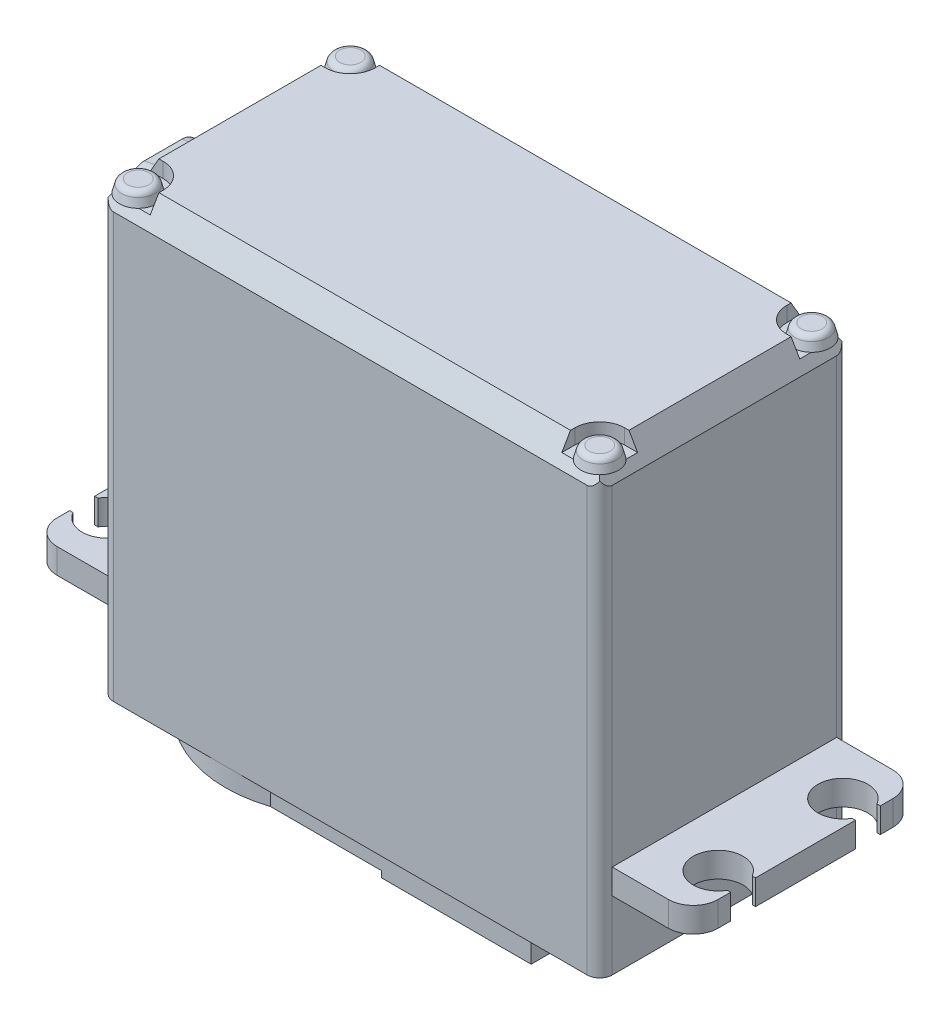
from build123d import *

# Parameters (mm, degrees)
SKETCH_1_W                 = 40
SKETCH_1_H                 = 20
EXTRUDE_1_DEPTH            = 28.5
SKETCH_7_R                 = 2.5
EXTRUDE_4_DEPTH            = 6.975384219
SKETCH_1_2_W               = 40
SKETCH_1_2_H               = 20
EXTRUDE_5_DEPTH            = 7.5
SKETCH_3_W                 = 53
SKETCH_3_H                 = 18
EXTRUDE_6_DEPTH            = 2
CUT_EXTRUDE_4_DEPTH        = 5
EXTRUDE_7_DEPTH            = 1.5
SKETCH_13_W                = 12
SKETCH_13_H                = 19
EXTRUDE_8_DEPTH            = 2
SKETCH_14_R                = 6
EXTRUDE_9_DEPTH            = 1.5
EXTRUDE_10_DEPTH           = 0.25
CUT_EXTRUDE_5_DEPTH        = 50
CUT_EXTRUDE_6_DEPTH        = 50
CUT_EXTRUDE_11_DEPTH       = 1.2
SKETCH_25_R                = 1.5
EXTRUDE_12_DEPTH           = 1
EXTRUDE_12_DRAFT           = 15
EXTRUDE_12_PROFILE_2_DEPTH = 1
EXTRUDE_12_PROFILE_2_DRAFT = 15
EXTRUDE_12_PROFILE_3_DEPTH = 1
EXTRUDE_12_PROFILE_3_DRAFT = 15
EXTRUDE_12_PROFILE_4_DEPTH = 1
EXTRUDE_12_PROFILE_4_DRAFT = 15
SKETCH_29_R                = 6.25
EXTRUDE_15_DEPTH           = 1.2
SKETCH_30_R                = 5
EXTRUDE_16_DEPTH           = 0.3
EXTRUDE_17_DEPTH           = 3.5
SKETCH_33_R                = 1.25
CUT_EXTRUDE_12_DEPTH       = 10
FILLET_1_R                 = 2
FILLET_2_R                 = 1
FILLET_4_R                 = 0.5
SKETCH_34_W                = 7
SKETCH_34_H                = 4.5
EXTRUDE_18_DEPTH           = 1
EXTRUDE_19_DEPTH           = 4
EXTRUDE_19_TAPER           = 10


with BuildPart() as part:
    # 草图1 → 凸台-拉伸1 (new body)
    with BuildSketch(Plane(origin=(0, 0, 0), x_dir=(1, 0, 0), z_dir=(0, 1, 0))):
        with Locations((20, -10)):
            Rectangle(SKETCH_1_W, SKETCH_1_H)
    extrude(amount=EXTRUDE_1_DEPTH)

    # 草图7 → 凸台-拉伸4 (add)
    with BuildSketch(Plane(origin=(0, 0, 0), x_dir=(1, 0, 0), z_dir=(0, 1, 0))):
        with Locations(Location((10, -10, 0), (0, 0, 270))):
            Circle(SKETCH_7_R)
    extrude(amount=-EXTRUDE_4_DEPTH)

    # 草图1<2> → 凸台-拉伸5 (add)
    with BuildSketch(Plane(origin=(0, 0, 0), x_dir=(1, 0, 0), z_dir=(0, 1, 0))):
        with Locations((20, -10)):
            Rectangle(SKETCH_1_2_W, SKETCH_1_2_H)
    extrude(amount=-EXTRUDE_5_DEPTH)

    # 草图3 → 凸台-拉伸6 (add)
    with BuildSketch(Plane(origin=(0, 0, 0), x_dir=(1, 0, 0), z_dir=(0, 1, 0))):
        with Locations((20, -10)):
            Rectangle(SKETCH_3_W, SKETCH_3_H)
    extrude(amount=-EXTRUDE_6_DEPTH)

    # 草图8 → 切除-拉伸4 (cut, symmetric)
    with BuildSketch(Plane(origin=(0, 0, 0), x_dir=(1, 0, 0), z_dir=(0, 1, 0))):
        with BuildLine():
            Line((-9.5, -4), (-9.5, -6))
            Line((-9.5, -6), (-6.232050808, -6))
            ThreePointArc((-6.232050808, -6), (-2.5, -5), (-6.232050808, -4))
            Line((-6.232050808, -4), (-9.5, -4))
        make_face()
        with BuildLine():
            Line((-6.232050808, -14), (-9.5, -14))
            Line((-9.5, -14), (-9.5, -16))
            Line((-9.5, -16), (-6.232050808, -16))
            ThreePointArc((-6.232050808, -16), (-2.5, -15), (-6.232050808, -14))
        make_face()
        with BuildLine():
            Line((49.5, -6), (49.5, -4))
            Line((49.5, -4), (46.232050808, -4))
            ThreePointArc((46.232050808, -4), (42.5, -5), (46.232050808, -6))
            Line((46.232050808, -6), (49.5, -6))
        make_face()
        with BuildLine():
            Line((49.5, -16), (49.5, -14))
            Line((49.5, -14), (46.232050808, -14))
            ThreePointArc((46.232050808, -14), (42.5, -15), (46.232050808, -16))
            Line((46.232050808, -16), (49.5, -16))
        make_face()
    extrude(amount=CUT_EXTRUDE_4_DEPTH, both=True, mode=Mode.SUBTRACT)

    # 草图9 → 凸台-拉伸7 (add)
    with BuildSketch(Plane.XZ.offset(7.5)):
        with BuildLine():
            Line((34, 19.5), (34, 0.5))
            Line((34, 0.5), (13.122498999, 0.5))
            ThreePointArc((13.122498999, 0.5), (0, 10), (13.122498999, 19.5))
            Line((13.122498999, 19.5), (34, 19.5))
        make_face()
    extrude(amount=EXTRUDE_7_DEPTH)

    # 草图13 → 凸台-拉伸8 (add)
    with BuildSketch(Plane.XZ.offset(7.5)):
        with Locations((28, 10)):
            Rectangle(SKETCH_13_W, SKETCH_13_H)
    extrude(amount=EXTRUDE_8_DEPTH)

    # 草图14 → 凸台-拉伸9 (add)
    with BuildSketch(Plane.XZ.offset(7.5)):
        with Locations((31, 10)):
            Circle(SKETCH_14_R)
    extrude(amount=EXTRUDE_9_DEPTH)

    # 草图15 → 凸台-拉伸10 (add, symmetric)
    with BuildSketch(Plane(origin=(0, 0, 10), x_dir=(-1, 0, 0), z_dir=(0, 0, -1))):
        Polygon((0, -3.2), (-40, -3.2), (-46.5, -2), (6.5, -2), align=None)
    extrude(amount=EXTRUDE_10_DEPTH, both=True)

    # 草图16 → 切除-拉伸5 (cut, symmetric)
    with BuildSketch(Plane.XY):
        Polygon((0, 26.5), (1.154700538, 28.5), (38.845299462, 28.5), (40, 26.5), (45, 26.5), (45, 36.5), (-5, 36.5), (-5, 26.5), align=None)
    extrude(amount=CUT_EXTRUDE_5_DEPTH, both=True, mode=Mode.SUBTRACT)

    # 草图18 → 切除-拉伸6 (cut, symmetric)
    with BuildSketch(Plane(origin=(0, 0, 0), x_dir=(0, 0, -1), z_dir=(1, 0, 0))):
        Polygon((-20, 26.5), (-18.845299462, 28.5), (-1.154700538, 28.5), (0, 26.5), (15, 26.5), (15, 36.5), (-35, 36.5), (-35, 26.5), align=None)
    extrude(amount=CUT_EXTRUDE_6_DEPTH, both=True, mode=Mode.SUBTRACT)

    # 草图22 → 切除-拉伸11 (cut)
    with BuildSketch(Plane(origin=(0, 28.5, 0), x_dir=(1, 0, 0), z_dir=(0, 1, 0))):
        with BuildLine():
            ThreePointArc((1.5, -3.5), (2.914213562, -2.914213562), (3.5, -1.5))
            Line((3.5, -1.5), (3.5, 0.5))
            Line((3.5, 0.5), (-0.5, 0.5))
            Line((-0.5, 0.5), (-0.5, -3.5))
            Line((-0.5, -3.5), (1.5, -3.5))
        make_face()
        with BuildLine():
            Line((3.5, -20.5), (3.5, -18.5))
            ThreePointArc((3.5, -18.5), (2.914213562, -17.085786438), (1.5, -16.5))
            Line((1.5, -16.5), (-0.5, -16.5))
            Line((-0.5, -16.5), (-0.5, -20.5))
            Line((-0.5, -20.5), (3.5, -20.5))
        make_face()
        with BuildLine():
            ThreePointArc((38.5, -16.5), (37.085786438, -17.085786438), (36.5, -18.5))
            Line((36.5, -18.5), (36.5, -20.5))
            Line((36.5, -20.5), (40.5, -20.5))
            Line((40.5, -20.5), (40.5, -16.5))
            Line((40.5, -16.5), (38.5, -16.5))
        make_face()
        with BuildLine():
            Line((36.5, 0.5), (36.5, -1.5))
            ThreePointArc((36.5, -1.5), (37.085786438, -2.914213562), (38.5, -3.5))
            Line((38.5, -3.5), (40.5, -3.5))
            Line((40.5, -3.5), (40.5, 0.5))
            Line((40.5, 0.5), (36.5, 0.5))
        make_face()
    extrude(amount=-CUT_EXTRUDE_11_DEPTH, mode=Mode.SUBTRACT)


with BuildPart() as extrude_12_tool:
    # 草图25 → 凸台-拉伸12 (with draft: the straight prism first)
    with BuildSketch(Plane(origin=(0, 27.3, 0), x_dir=(1, 0, 0), z_dir=(0, 1, 0))):
        with Locations((1.5, -1.5)):
            Circle(SKETCH_25_R)
    extrude(amount=EXTRUDE_12_DEPTH)
    # 凸台-拉伸12: the draft: its side faces are tilted about the plane it starts from
    extrude_12_sides = [extrude_12_tool.faces().sort_by_distance(p)[0] for p in [
        (0, 27.8, 1.5),
    ]]
    draft(extrude_12_sides, Plane(origin=(0, 27.3, 0), x_dir=(1, 0, 0), z_dir=(0, 1, 0)), EXTRUDE_12_DRAFT)


with BuildPart() as part_1:
    add(part.part)

    # 凸台-拉伸12: add extrude_12_tool
    add(extrude_12_tool.part)


with BuildPart() as extrude_12_profile_2_tool:
    # 草图25 → 凸台-拉伸12 profile 2 (with draft: the straight prism first)
    with BuildSketch(Plane(origin=(0, 27.3, 0), x_dir=(1, 0, 0), z_dir=(0, 1, 0))):
        with Locations((38.5, -1.5)):
            Circle(SKETCH_25_R)
    extrude(amount=EXTRUDE_12_PROFILE_2_DEPTH)
    # 凸台-拉伸12 profile 2: the draft: its side faces are tilted about the plane it starts from
    extrude_12_profile_2_sides = [extrude_12_profile_2_tool.faces().sort_by_distance(p)[0] for p in [
        (37, 27.8, 1.5),
    ]]
    draft(extrude_12_profile_2_sides, Plane(origin=(0, 27.3, 0), x_dir=(1, 0, 0), z_dir=(0, 1, 0)), EXTRUDE_12_PROFILE_2_DRAFT)


with BuildPart() as part_2:
    add(part_1.part)

    # 凸台-拉伸12 profile 2: add extrude_12_profile_2_tool
    add(extrude_12_profile_2_tool.part)


with BuildPart() as extrude_12_profile_3_tool:
    # 草图25 → 凸台-拉伸12 profile 3 (with draft: the straight prism first)
    with BuildSketch(Plane(origin=(0, 27.3, 0), x_dir=(1, 0, 0), z_dir=(0, 1, 0))):
        with Locations((38.5, -18.5)):
            Circle(SKETCH_25_R)
    extrude(amount=EXTRUDE_12_PROFILE_3_DEPTH)
    # 凸台-拉伸12 profile 3: the draft: its side faces are tilted about the plane it starts from
    extrude_12_profile_3_sides = [extrude_12_profile_3_tool.faces().sort_by_distance(p)[0] for p in [
        (37, 27.8, 18.5),
    ]]
    draft(extrude_12_profile_3_sides, Plane(origin=(0, 27.3, 0), x_dir=(1, 0, 0), z_dir=(0, 1, 0)), EXTRUDE_12_PROFILE_3_DRAFT)


with BuildPart() as part_3:
    add(part_2.part)

    # 凸台-拉伸12 profile 3: add extrude_12_profile_3_tool
    add(extrude_12_profile_3_tool.part)


with BuildPart() as extrude_12_profile_4_tool:
    # 草图25 → 凸台-拉伸12 profile 4 (with draft: the straight prism first)
    with BuildSketch(Plane(origin=(0, 27.3, 0), x_dir=(1, 0, 0), z_dir=(0, 1, 0))):
        with Locations((1.5, -18.5)):
            Circle(SKETCH_25_R)
    extrude(amount=EXTRUDE_12_PROFILE_4_DEPTH)
    # 凸台-拉伸12 profile 4: the draft: its side faces are tilted about the plane it starts from
    extrude_12_profile_4_sides = [extrude_12_profile_4_tool.faces().sort_by_distance(p)[0] for p in [
        (0, 27.8, 18.5),
    ]]
    draft(extrude_12_profile_4_sides, Plane(origin=(0, 27.3, 0), x_dir=(1, 0, 0), z_dir=(0, 1, 0)), EXTRUDE_12_PROFILE_4_DRAFT)


with BuildPart() as part_4:
    add(part_3.part)

    # 凸台-拉伸12 profile 4: add extrude_12_profile_4_tool
    add(extrude_12_profile_4_tool.part)

    # 草图29 → 凸台-拉伸15 (add)
    with BuildSketch(Plane.XZ.offset(9)):
        with Locations(Location((10, 10, 0), (0, 0, 270))):
            Circle(SKETCH_29_R)
    extrude(amount=EXTRUDE_15_DEPTH)

    # 草图30 → 凸台-拉伸16 (add)
    with BuildSketch(Plane.XZ.offset(10.2)):
        with Locations(Location((10, 10, 0), (0, 0, 270))):
            Circle(SKETCH_30_R)
    extrude(amount=EXTRUDE_16_DEPTH)

    # 草图31 → 凸台-拉伸17 (add)
    with BuildSketch(Plane.XZ.offset(10.5)):
        Polygon((12.976344104, 10.375999701), (12.421457903, 10.621724718), (12.789329458, 11.104373658), (12.1907667, 11.204384185), (12.427050983, 11.763355757), (11.822421569, 11.711367765), (11.912271969, 12.311539728), (11.339566987, 12.110819814), (11.277337875, 12.714481157), (10.772542486, 12.377641291), (10.562143944, 12.946861752), (10.156976299, 12.495066821), (9.811628441, 12.994080185), (9.531546714, 12.455718127), (9.072949017, 12.853169549), (8.935551771, 12.262067631), (8.392519615, 12.532983777), (8.406440026, 11.926283107), (7.813094118, 12.053641318), (7.977457514, 11.469463131), (7.37107996, 11.445261022), (7.675558785, 10.920311382), (7.094250517, 10.746069661), (7.519713247, 10.313333084), (7, 10), (7.519713247, 9.686666916), (7.094250517, 9.253930339), (7.675558785, 9.079688618), (7.37107996, 8.554738978), (7.977457514, 8.530536869), (7.813094118, 7.946358682), (8.406440026, 8.073716893), (8.392519615, 7.467016223), (8.935551771, 7.737932369), (9.072949017, 7.146830451), (9.531546714, 7.544281873), (9.811628441, 7.005919815), (10.156976299, 7.504933179), (10.562143944, 7.053138248), (10.772542486, 7.622358709), (11.277337875, 7.285518843), (11.339566987, 7.889180186), (11.912271969, 7.688460272), (11.822421569, 8.288632235), (12.427050983, 8.236644243), (12.1907667, 8.795615815), (12.789329458, 8.895626342), (12.421457903, 9.378275282), (12.976344104, 9.624000299), (12.5, 10), align=None)
    extrude(amount=EXTRUDE_17_DEPTH)

    # 草图33 → 切除-拉伸12 (cut)
    with BuildSketch(Plane.XZ.offset(10.5)):
        with Locations(Location((10, 10, 0), (0, 0, 90))):
            Circle(SKETCH_33_R)
    extrude(amount=CUT_EXTRUDE_12_DEPTH, mode=Mode.SUBTRACT)

    # 圆角1
    fillet_1_edges = [part_4.edges().sort_by_distance(p)[0] for p in [
        (-6.5, -1, 1),
        (46.5, -1, 19),
        (-6.5, -1, 19),
        (46.5, -1, 1),
    ]]
    fillet(fillet_1_edges, radius=FILLET_1_R)

    # 圆角2
    fillet_2_edges = [part_4.edges().sort_by_distance(p)[0] for p in [
        (40, 9.5, 0),
        (0, 9.5, 0),
        (0, 9.5, 20),
        (40, 9.5, 20),
    ]]
    fillet(fillet_2_edges, radius=FILLET_2_R - 0.0001)  # a hair under: the kernel refuses the full size

    # 圆角4
    fillet_4_edges = [part_4.edges().sort_by_distance(p)[0] for p in [
        (0.267949192, 28.3, 1.5),
        (37.267949192, 28.3, 1.5),
        (37.267949192, 28.3, 18.5),
        (0.267949192, 28.3, 18.5),
    ]]
    fillet(fillet_4_edges, radius=FILLET_4_R)

    # 草图34 → 凸台-拉伸18 (add)
    with BuildSketch(Plane.ZY):
        with Locations((10, 21.5)):
            Rectangle(SKETCH_34_W, SKETCH_34_H)
    extrude(amount=EXTRUDE_18_DEPTH)

    # 草图35 → 凸台-拉伸19 (add)
    with BuildSketch(Plane.ZY.offset(1)):
        with BuildLine():
            ThreePointArc((8.5, 23.5), (6.5, 21.5), (8.5, 19.5))
            Line((8.5, 19.5), (11.5, 19.5))
            ThreePointArc((11.5, 19.5), (13.5, 21.5), (11.5, 23.5))
            Line((11.5, 23.5), (8.5, 23.5))
        make_face()
    extrude(amount=EXTRUDE_19_DEPTH, taper=EXTRUDE_19_TAPER)


solid = part_4.part
